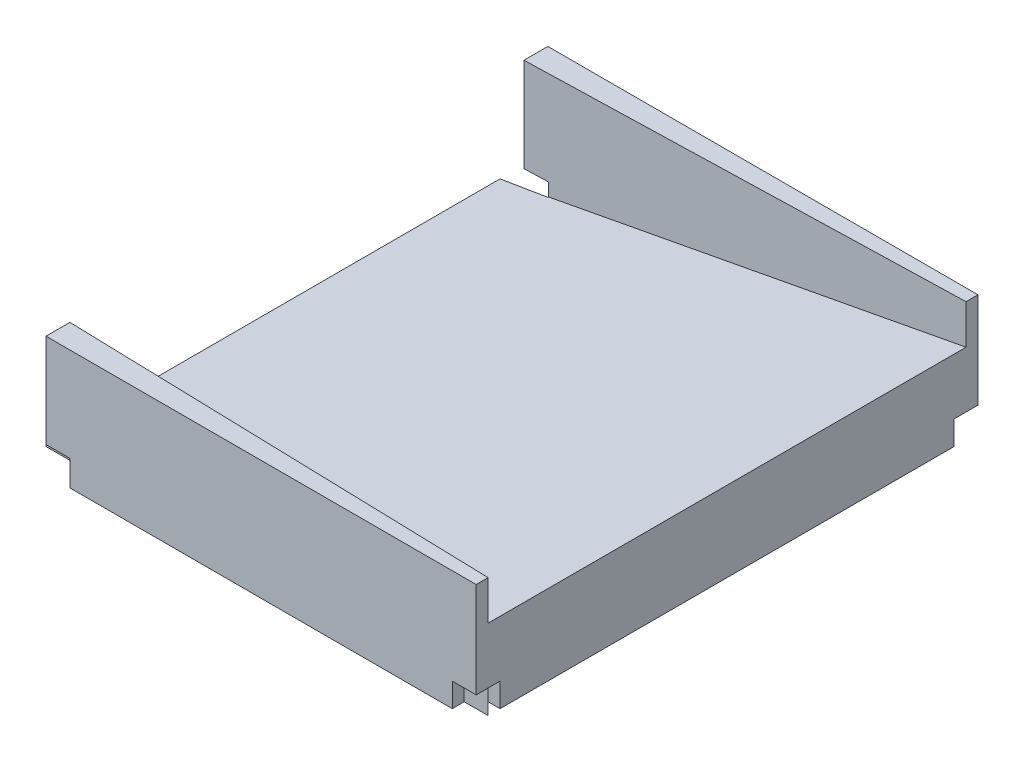
from build123d import *

# Parameters (mm, degrees)
BOSS_EXTRU_1_DEPTH      = 200
ESQUISSE4_W             = 5
ESQUISSE4_H             = 50
BOSS_EXTRU_4_DEPTH      = 180
BOSS_EXTRU_7_REACH      = 238.046
ESQUISSE5_W             = 10
ESQUISSE5_H             = 10
ENL_V_MAT_EXTRU_1_DEPTH = 10
ESQUISSE6_W             = 20
ESQUISSE6_H             = 10.719834163
ENL_V_MAT_EXTRU_2_DEPTH = 10
SYM_TRIE3_DEPTH         = 10.719834163
SYM_TRIE3_2_DEPTH       = 50
SYM_TRIE3_START         = 10.719834163
SYM_TRIE3_3_DEPTH       = 39.280165837


# Read off the part's stored shape, not the designer's step: Symétrie3
with BuildPart() as part:
    # Esquisse1 → Boss.-Extru.1 (new body)
    with BuildSketch(Plane.XY):
        Polygon((-105.796013405, 0), (84.203986595, 0), (84.203986595, 33.502126335), (-105.796013405, 2), align=None)
    extrude(amount=BOSS_EXTRU_1_DEPTH)

    # Esquisse4 → Boss.-Extru.4 (add)
    with BuildSketch(Plane(origin=(84.203986595, 0, 0), x_dir=(0, 0, -1), z_dir=(1, 0, 0))):
        with Locations((-202.5, 25)):
            Rectangle(ESQUISSE4_W, ESQUISSE4_H)
        with Locations((2.5, 25)):
            Rectangle(ESQUISSE4_W, ESQUISSE4_H)
    extrude(amount=-BOSS_EXTRU_4_DEPTH)

    # Boss.-Extru.7: up to this plane
    boss_extru_7_end = Plane(origin=(-105.796013405, 2, 200), z_dir=(0.16356768062493265, -0.9865321149638162, 0))
    # Esquisse8 → Boss.-Extru.7 (add, up to the surface)
    with BuildSketch(Plane(origin=(0, 50, 0), x_dir=(1, 0, 0), z_dir=(0, 1, 0)), mode=Mode.PRIVATE) as boss_extru_7_sk1:
        Polygon((84.203986595, 0), (-95.796013405, 0), (-95.796013405, -5), align=None)
    boss_extru_7_tool1 = split(extrude(boss_extru_7_sk1.sketch, amount=-BOSS_EXTRU_7_REACH, mode=Mode.PRIVATE), bisect_by=boss_extru_7_end, keep=Keep.BOTH, mode=Mode.PRIVATE)
    add(boss_extru_7_tool1.solids().sort_by_distance((-35.796013, 50, 1.666667))[0])

    # Esquisse5 → Enlèv. mat.-Extru.1 (cut)
    with BuildSketch(Plane(origin=(84.203986595, 0, 0), x_dir=(0, 0, -1), z_dir=(1, 0, 0))):
        with Locations((-200, 5)):
            Rectangle(ESQUISSE5_W, ESQUISSE5_H)
        with Locations((0, 5)):
            Rectangle(ESQUISSE5_W, ESQUISSE5_H)
    extrude(amount=-ENL_V_MAT_EXTRU_1_DEPTH, mode=Mode.SUBTRACT)

    # Esquisse6 → Enlèv. mat.-Extru.2 (cut)
    with BuildSketch(Plane(origin=(0, 0, -5), x_dir=(-1, 0, 0), z_dir=(0, 0, -1))):
        with Locations((95.796013405, 5.359917081)):
            Rectangle(ESQUISSE6_W, ESQUISSE6_H)
    extrude(amount=-ENL_V_MAT_EXTRU_2_DEPTH, mode=Mode.SUBTRACT)

    # Symétrie3 outline → Symétrie3 (cut)
    with BuildSketch(Plane(origin=(0, 0, 0), x_dir=(1, 0, 0), z_dir=(0, 1, 0))):
        Polygon((-95.796013405, -200), (-95.796013405, -205), (-85.796013405, -205), (-85.796013405, -195), (-105.796013405, -195), (-105.796013405, -200), align=None)
    extrude(amount=SYM_TRIE3_DEPTH, mode=Mode.SUBTRACT)

    # Sym_trie3 2 outline → Sym_trie3 2 (add)
    with BuildSketch(Plane(origin=(0, 0, 0), x_dir=(1, 0, 0), z_dir=(0, 1, 0))):
        Polygon((-85.796013405, -195.277777778), (-85.796013405, -200), (84.203986595, -200), align=None)
    extrude(amount=SYM_TRIE3_2_DEPTH)

    # Sym_trie3 3 outline → Sym_trie3 3 (add)
    with BuildSketch(Plane(origin=(0, 0, 0), x_dir=(1, 0, 0), z_dir=(0, 1, 0)).offset(SYM_TRIE3_START)):
        Polygon((-95.796013405, -195), (-95.796013405, -200), (-85.796013405, -200), (-85.796013405, -195.277777778), align=None)
    extrude(amount=SYM_TRIE3_3_DEPTH)


solid = part.part
